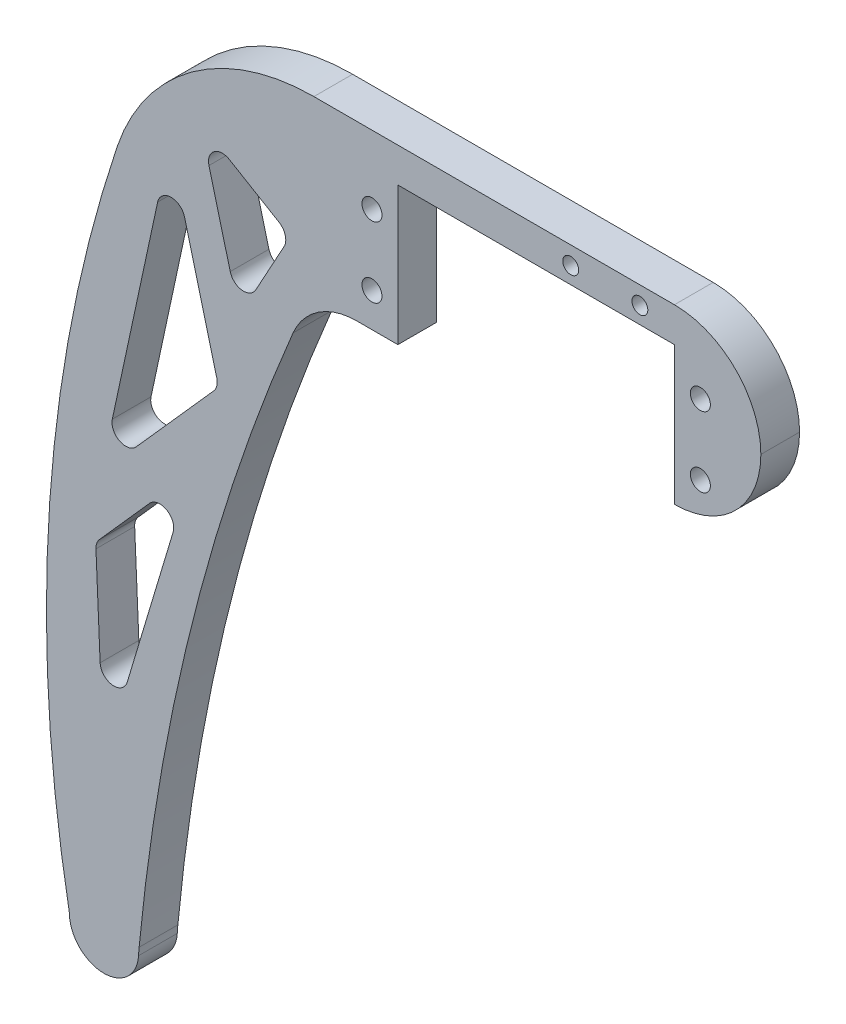
from build123d import *

# Parameters (mm, degrees)
BOSS_EXTRU_1_DEPTH      = 5.6
ENL_V_MAT_EXTRU_1_REACH = 135.059
ESQUISSE2_W             = 40
ESQUISSE2_H             = 20
ENL_V_MAT_EXTRU_2_REACH = 135.059
ESQUISSE3_R             = 1.45
CONG_2_R                = 12.5
CONG_3_R                = 10
CONG_4_R                = 30
CONG_5_R                = 30
ENL_V_MAT_EXTRU_3_REACH = 135.059
CONG_6_R                = 2
ENL_V_MAT_EXTRU_4_REACH = 135.059
ESQUISSE5_R             = 1.15


# Some blends are built 0.0001 mm under size
with BuildPart() as part:
    # Esquisse1 → Boss.-Extru.1 (new body)
    with BuildSketch(Plane.XY):
        with BuildLine():
            Line((-32.5, 12.5), (-52.5, 12.5))
            ThreePointArc((-52.5, 12.5), (-69.287355537, -46.339080558), (-67.5, -107.5))
            ThreePointArc((-67.5, -107.5), (-62.5, -112.5), (-57.5, -107.5))
            ThreePointArc((-57.5, -107.5), (-48.914858734, -58.969774017), (-32.5, -12.5))
            Line((-32.5, -12.5), (32.5, -12.5))
            Line((32.5, -12.5), (32.5, 12.5))
            Line((32.5, 12.5), (-32.5, 12.5))
        make_face()
    extrude(amount=BOSS_EXTRU_1_DEPTH)

    # Esquisse2 → Enlèv. mat.-Extru.1 (cut, up to next)
    with BuildSketch(Plane.XY.offset(5.6), mode=Mode.PRIVATE) as enl_v_mat_extru_1_sk1:
        with Locations((0, -2.5)):
            Rectangle(ESQUISSE2_W, ESQUISSE2_H)
    enl_v_mat_extru_1_tool1 = extrude(enl_v_mat_extru_1_sk1.sketch, amount=-ENL_V_MAT_EXTRU_1_REACH, mode=Mode.PRIVATE) & part.part
    add(enl_v_mat_extru_1_tool1.solids().sort_by_distance((0, -2.5, 5.6))[0], mode=Mode.SUBTRACT)

    # Esquisse3 → Enlèv. mat.-Extru.2 (cut, up to next)
    with BuildSketch(Plane.XY.offset(5.6), mode=Mode.PRIVATE) as enl_v_mat_extru_2_sk1:
        with Locations((-23.75, -7.58)):
            Circle(ESQUISSE3_R)
    enl_v_mat_extru_2_tool1 = extrude(enl_v_mat_extru_2_sk1.sketch, amount=-ENL_V_MAT_EXTRU_2_REACH, mode=Mode.PRIVATE) & part.part
    # Esquisse3 → Enlèv. mat.-Extru.2 (cut, up to next)
    with BuildSketch(Plane.XY.offset(5.6), mode=Mode.PRIVATE) as enl_v_mat_extru_2_sk2:
        with Locations((23.75, -7.58)):
            Circle(ESQUISSE3_R)
    enl_v_mat_extru_2_tool2 = extrude(enl_v_mat_extru_2_sk2.sketch, amount=-ENL_V_MAT_EXTRU_2_REACH, mode=Mode.PRIVATE) & part.part
    # Esquisse3 → Enlèv. mat.-Extru.2 (cut, up to next)
    with BuildSketch(Plane.XY.offset(5.6), mode=Mode.PRIVATE) as enl_v_mat_extru_2_sk3:
        with Locations((23.75, 2.58)):
            Circle(ESQUISSE3_R)
    enl_v_mat_extru_2_tool3 = extrude(enl_v_mat_extru_2_sk3.sketch, amount=-ENL_V_MAT_EXTRU_2_REACH, mode=Mode.PRIVATE) & part.part
    # Esquisse3 → Enlèv. mat.-Extru.2 (cut, up to next)
    with BuildSketch(Plane.XY.offset(5.6), mode=Mode.PRIVATE) as enl_v_mat_extru_2_sk4:
        with Locations((-23.75, 2.58)):
            Circle(ESQUISSE3_R)
    enl_v_mat_extru_2_tool4 = extrude(enl_v_mat_extru_2_sk4.sketch, amount=-ENL_V_MAT_EXTRU_2_REACH, mode=Mode.PRIVATE) & part.part
    add(enl_v_mat_extru_2_tool1.solids().sort_by_distance((-23.75, -7.58, 5.6))[0], mode=Mode.SUBTRACT)
    add(enl_v_mat_extru_2_tool2.solids().sort_by_distance((23.75, -7.58, 5.6))[0], mode=Mode.SUBTRACT)
    add(enl_v_mat_extru_2_tool3.solids().sort_by_distance((23.75, 2.58, 5.6))[0], mode=Mode.SUBTRACT)
    add(enl_v_mat_extru_2_tool4.solids().sort_by_distance((-23.75, 2.58, 5.6))[0], mode=Mode.SUBTRACT)

    # Congé2
    cong_2_edges = [part.edges().sort_by_distance(p)[0] for p in [
        (32.5, -12.5, 2.8),
        (32.5, 12.5, 2.8),
    ]]
    fillet(cong_2_edges, radius=CONG_2_R - 0.0001)  # a hair under: the kernel refuses the full size

    # Congé3
    cong_3_edges = [part.edges().sort_by_distance(p)[0] for p in [
        (-32.5, -12.5, 2.8),
    ]]
    fillet(cong_3_edges, radius=CONG_3_R)

    # Congé4
    cong_4_edges = [part.edges().sort_by_distance(p)[0] for p in [
        (-52.5, 12.5, 2.8),
    ]]
    fillet(cong_4_edges, radius=CONG_4_R)

    # Congé5
    # the kernel refuses this fillet: 30 mm, written as the material it adds along each edge
    with BuildSketch(Plane(origin=(-57.5, -107.5, 0), x_dir=(-0.029294676062998543, -0.9995708188789647, 0), z_dir=(0, 0, 1))) as cong_5_piece_1:
        with BuildLine():
            CenterArc((1.171787043, 29.987124566), CONG_5_R, 266.202223448, 2.119075089)
            ThreePointArc((-0.815268333, 0.053003384), (-0.407652209, 0.026224165), (0, 0))
            ThreePointArc((0, 0), (0.14647338, 0.002145906), (0.292946761, 0))
        make_face()
    extrude(amount=5.6)

    # Esquisse4 → Enlèv. mat.-Extru.3 (cut, up to next)
    with BuildSketch(Plane.XY.offset(5.6), mode=Mode.PRIVATE) as enl_v_mat_extru_3_sk1:
        Polygon((-35.530484253, -6.741676359), (-42.974151572, -20.332321303), (-48.555833289, 0.989708193), align=None)
    enl_v_mat_extru_3_tool1 = extrude(enl_v_mat_extru_3_sk1.sketch, amount=-ENL_V_MAT_EXTRU_3_REACH, mode=Mode.PRIVATE) & part.part
    # Esquisse4 → Enlèv. mat.-Extru.3 (cut, up to next)
    with BuildSketch(Plane.XY.offset(5.6), mode=Mode.PRIVATE) as enl_v_mat_extru_3_sk2:
        Polygon((-52.982896502, -3.816878406), (-45.919055028, -30.800759586), (-62.900626013, -49.913479621), align=None)
    enl_v_mat_extru_3_tool2 = extrude(enl_v_mat_extru_3_sk2.sketch, amount=-ENL_V_MAT_EXTRU_3_REACH, mode=Mode.PRIVATE) & part.part
    # Esquisse4 → Enlèv. mat.-Extru.3 (cut, up to next)
    with BuildSketch(Plane.XY.offset(5.6), mode=Mode.PRIVATE) as enl_v_mat_extru_3_sk3:
        Polygon((-49.898192375, -43.559912364), (-63.702500518, -59.0966302), (-62.552958266, -85.696486809), align=None)
    enl_v_mat_extru_3_tool3 = extrude(enl_v_mat_extru_3_sk3.sketch, amount=-ENL_V_MAT_EXTRU_3_REACH, mode=Mode.PRIVATE) & part.part
    add(enl_v_mat_extru_3_tool1.solids().sort_by_distance((-42.35349, -8.694763, 5.6))[0], mode=Mode.SUBTRACT)
    add(enl_v_mat_extru_3_tool2.solids().sort_by_distance((-53.934193, -28.177039, 5.6))[0], mode=Mode.SUBTRACT)
    add(enl_v_mat_extru_3_tool3.solids().sort_by_distance((-58.717884, -62.784343, 5.6))[0], mode=Mode.SUBTRACT)

    # Congé6
    cong_6_edges = [part.edges().sort_by_distance(p)[0] for p in [
        (-48.555833289, 0.989708193, 2.8),
        (-35.530484253, -6.741676359, 2.8),
        (-42.974151572, -20.332321303, 2.8),
        (-62.900626013, -49.913479621, 2.8),
        (-52.982896502, -3.816878406, 2.8),
        (-45.919055028, -30.800759586, 2.8),
        (-49.898192375, -43.559912364, 2.8),
        (-62.552958266, -85.696486809, 2.8),
        (-63.702500518, -59.0966302, 2.8),
    ]]
    fillet(cong_6_edges, radius=CONG_6_R)

    # Esquisse5 → Enlèv. mat.-Extru.4 (cut, up to next)
    with BuildSketch(Plane.XY.offset(5.6), mode=Mode.PRIVATE) as enl_v_mat_extru_4_sk1:
        with Locations((15, 9.91)):
            Circle(ESQUISSE5_R)
    enl_v_mat_extru_4_tool1 = extrude(enl_v_mat_extru_4_sk1.sketch, amount=-ENL_V_MAT_EXTRU_4_REACH, mode=Mode.PRIVATE) & part.part
    # Esquisse5 → Enlèv. mat.-Extru.4 (cut, up to next)
    with BuildSketch(Plane.XY.offset(5.6), mode=Mode.PRIVATE) as enl_v_mat_extru_4_sk2:
        with Locations((5, 9.91)):
            Circle(ESQUISSE5_R)
    enl_v_mat_extru_4_tool2 = extrude(enl_v_mat_extru_4_sk2.sketch, amount=-ENL_V_MAT_EXTRU_4_REACH, mode=Mode.PRIVATE) & part.part
    add(enl_v_mat_extru_4_tool1.solids().sort_by_distance((15, 9.91, 5.6))[0], mode=Mode.SUBTRACT)
    add(enl_v_mat_extru_4_tool2.solids().sort_by_distance((5, 9.91, 5.6))[0], mode=Mode.SUBTRACT)


solid = part.part
